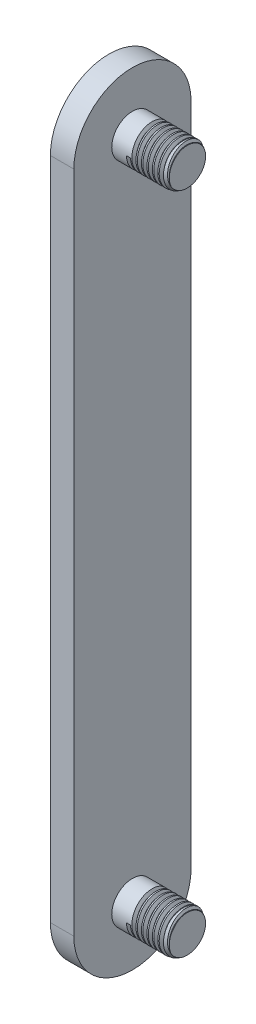
from build123d import *
from OCP.BRepFilletAPI import BRepFilletAPI_MakeChamfer

# Parameters (mm, degrees)
SKETCH_1_R        = 2.65
EXTRUDE_1_DEPTH   = 10
EXTRUDE_1_2_DEPTH = 10
SKETCH_1_3_R      = 2.65
EXTRUDE_2_DEPTH   = 3
CHAMFER_3_SIZE    = 0.5
CHAMFER_3_SIZE2   = 0.288675135
THREAD_2_PITCH    = 0.7
THREAD_3_PITCH    = 0.7


with BuildPart() as part:
    # 스케치1 → 보스-돌출1 (new body)
    with BuildSketch(Plane(origin=(0, 0, 0), x_dir=(0, 0, -1), z_dir=(1, 0, 0))):
        with Locations((7.5, -85)):
            Circle(SKETCH_1_R)
    extrude(amount=EXTRUDE_1_DEPTH)



with BuildPart() as body_2:
    # 스케치1 → Extrude 1 2 (new body)
    with BuildSketch(Plane(origin=(0, 0, 0), x_dir=(0, 0, -1), z_dir=(1, 0, 0))):
        with Locations((7.5, 0)):
            Circle(SKETCH_1_R)
    extrude(amount=EXTRUDE_1_2_DEPTH)


with BuildPart() as part_1:
    add(part.part)

    add(body_2.part)  # 보스-돌출2 merges body 2
    # 스케치1<3> → 보스-돌출2 (add)
    with BuildSketch(Plane(origin=(0, 0, 0), x_dir=(0, 0, -1), z_dir=(1, 0, 0))):
        with BuildLine():
            Line((0, -85), (0, 0))
            ThreePointArc((0, 0), (7.5, 7.5), (15, 0))
            Line((15, 0), (15, -85))
            ThreePointArc((15, -85), (7.5, -92.5), (0, -85))
        make_face()
        with Locations((7.5, -85)):
            Circle(SKETCH_1_3_R, mode=Mode.SUBTRACT)
        with Locations(Location((7.5, 0, 0), (0, 0, 180))):
            Circle(SKETCH_1_3_R, mode=Mode.SUBTRACT)
    extrude(amount=EXTRUDE_2_DEPTH)

    # 모따기3: one chamfer whose edges measure the first distance from different faces: ONE call of the kernel's chamfer builder (chamfer() names one face for all edges)
    chamfer_3_edges_1 = [part_1.edges().sort_by_distance(p)[0] for p in [
        (10, -85, -4.85),
    ]]
    chamfer_3_side_1 = [part_1.faces().sort_by_distance(p)[0] for p in [
        (6.5, -85, -4.85),
    ]]
    chamfer_3_edges_2 = [part_1.edges().sort_by_distance(p)[0] for p in [
        (10, 0, -4.85),
    ]]
    chamfer_3_side_2 = [part_1.faces().sort_by_distance(p)[0] for p in [
        (6.5, 0, -4.85),
    ]]
    chamfer_3 = BRepFilletAPI_MakeChamfer(part_1.part.solid().wrapped)
    for e in chamfer_3_edges_1:
        chamfer_3.Add(CHAMFER_3_SIZE, CHAMFER_3_SIZE2, e.wrapped, chamfer_3_side_1[0].wrapped)  # the first distance lies on this face
    for e in chamfer_3_edges_2:
        chamfer_3.Add(CHAMFER_3_SIZE, CHAMFER_3_SIZE2, e.wrapped, chamfer_3_side_2[0].wrapped)  # the first distance lies on this face
    add(Compound.cast(chamfer_3.Shape()), mode=Mode.REPLACE)

    # 나사산2: the profile of 나사산 프로파일2 profile screwed along a right-hand helix of 8 turns, 6 arcs to a turn; built about Z, then put on its axis
    thread_2_z = Axis((0, 0, 0), (0, 0, 1))
    thread_2_corners = [(2.6503, 0, -0.000173205), (2.271113888, 0, 0.218749999), (2.271113888, 0, 0.306249999), (2.6503, 0, 0.525173203)]
    with BuildLine(mode=Mode.PRIVATE) as thread_2_profile:
        Line(thread_2_corners[0], thread_2_corners[1])
        Line(thread_2_corners[1], thread_2_corners[2])
        Line(thread_2_corners[2], thread_2_corners[3])
        Line(thread_2_corners[3], thread_2_corners[0])
    thread_2_cap = Face(thread_2_profile.wire())
    thread_2_turn_angles = [0, 30, 60, 90, 120, 150, 180, 210, 240, 270, 300, 330, 360]
    thread_2_turn_weights = [1, 0.8660254037844387, 1, 0.8660254037844387, 1, 0.8660254037844387, 1, 0.8660254037844387, 1, 0.8660254037844387, 1, 0.8660254037844387, 1]
    thread_2_turn_rails = [Edge.make_bspline([Vector(p[0], p[1], 0).rotate(thread_2_z, thread_2_turn_angles[k]) / thread_2_turn_weights[k] + Vector(0, 0, p[2] + THREAD_2_PITCH * thread_2_turn_angles[k] / 360) for k in range(13)], [0, 0, 0, 1, 1, 2, 2, 3, 3, 4, 4, 5, 5, 6, 6, 6], 2, thread_2_turn_weights) for p in thread_2_corners]
    thread_2_turn_sides = [Face.make_surface_from_curves(thread_2_turn_rails[p[0]], thread_2_turn_rails[p[1]]) for p in [(0, 1), (1, 2), (2, 3), (3, 0)]]
    thread_2 = Plane(origin=(11, 0, -7.5), x_dir=(0, 0, 1), z_dir=(-1, 0, 0)) * Solid(Shell([*[p.moved(Location((0, 0, THREAD_2_PITCH * i))) for i in range(8) for p in thread_2_turn_sides], thread_2_cap, thread_2_cap.rotate(thread_2_z, 2880).moved(Location((0, 0, THREAD_2_PITCH * 2880 / 360)))]))
    add(thread_2, mode=Mode.SUBTRACT)

    # 나사산3: the profile of 나사산 프로파일3 profile screwed along a right-hand helix of 8 turns, 6 arcs to a turn; built about Z, then put on its axis
    thread_3_z = Axis((0, 0, 0), (0, 0, 1))
    thread_3_corners = [(2.6503, 0, -0.000173205), (2.271113888, 0, 0.218749999), (2.271113888, 0, 0.306249999), (2.6503, 0, 0.525173203)]
    with BuildLine(mode=Mode.PRIVATE) as thread_3_profile:
        Line(thread_3_corners[0], thread_3_corners[1])
        Line(thread_3_corners[1], thread_3_corners[2])
        Line(thread_3_corners[2], thread_3_corners[3])
        Line(thread_3_corners[3], thread_3_corners[0])
    thread_3_cap = Face(thread_3_profile.wire())
    thread_3_turn_angles = [0, 30, 60, 90, 120, 150, 180, 210, 240, 270, 300, 330, 360]
    thread_3_turn_weights = [1, 0.8660254037844387, 1, 0.8660254037844387, 1, 0.8660254037844387, 1, 0.8660254037844387, 1, 0.8660254037844387, 1, 0.8660254037844387, 1]
    thread_3_turn_rails = [Edge.make_bspline([Vector(p[0], p[1], 0).rotate(thread_3_z, thread_3_turn_angles[k]) / thread_3_turn_weights[k] + Vector(0, 0, p[2] + THREAD_3_PITCH * thread_3_turn_angles[k] / 360) for k in range(13)], [0, 0, 0, 1, 1, 2, 2, 3, 3, 4, 4, 5, 5, 6, 6, 6], 2, thread_3_turn_weights) for p in thread_3_corners]
    thread_3_turn_sides = [Face.make_surface_from_curves(thread_3_turn_rails[p[0]], thread_3_turn_rails[p[1]]) for p in [(0, 1), (1, 2), (2, 3), (3, 0)]]
    thread_3 = Plane(origin=(11, -85, -7.5), x_dir=(0, 0, 1), z_dir=(-1, 0, 0)) * Solid(Shell([*[p.moved(Location((0, 0, THREAD_3_PITCH * i))) for i in range(8) for p in thread_3_turn_sides], thread_3_cap, thread_3_cap.rotate(thread_3_z, 2880).moved(Location((0, 0, THREAD_3_PITCH * 2880 / 360)))]))
    add(thread_3, mode=Mode.SUBTRACT)


solid = part_1.part
